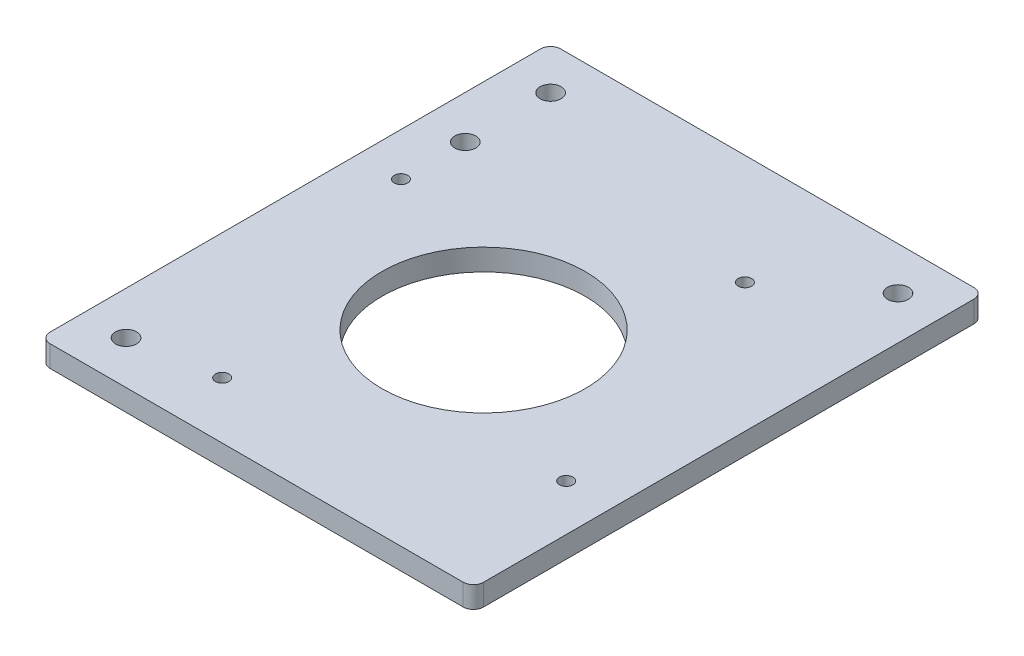
from build123d import *

# Parameters (mm, degrees)
SKETCH1_W           = 128
SKETCH1_H           = 150.8
SKETCH1_R           = 30
SKETCH1_R_2         = 3.1
BOSS_EXTRUDE1_DEPTH = 6.35
FILLET1_R           = 3
SKETCH3_R           = 1.985
CUT_EXTRUDE1_DEPTH  = 637.633938538


with BuildPart() as part:
    # Sketch1 → Boss-Extrude1 (new body)
    with BuildSketch(Plane(origin=(0, 0, 0), x_dir=(1, 0, 0), z_dir=(0, 1, 0))):
        with Locations((77.127334094, -545.362051651)):
            Rectangle(SKETCH1_W, SKETCH1_H)
        with Locations((76.627334094, -553.262051651)):
            Circle(SKETCH1_R, mode=Mode.SUBTRACT)
        with Locations((25.827334094, -482.662051651)):
            Circle(SKETCH1_R_2, mode=Mode.SUBTRACT)
        with Locations((128.427334094, -482.662051651)):
            Circle(SKETCH1_R_2, mode=Mode.SUBTRACT)
        with Locations((25.827334094, -608.062051651)):
            Circle(SKETCH1_R_2, mode=Mode.SUBTRACT)
        with Locations((25.827334094, -507.862051651)):
            Circle(SKETCH1_R_2, mode=Mode.SUBTRACT)
    extrude(amount=BOSS_EXTRUDE1_DEPTH)

    # Fillet1
    fillet1_edges = [part.edges().sort_by_distance(p)[0] for p in [
        (141.127334094, 3.175, 469.962051651),
        (141.127334094, 3.175, 620.762051651),
        (13.127334094, 3.175, 620.762051651),
        (13.127334094, 3.175, 469.962051651),
    ]]
    fillet(fillet1_edges, radius=FILLET1_R)

    # Sketch3 → Cut-Extrude1 (cut, through all)
    with BuildSketch(Plane(origin=(0, 6.35, 0), x_dir=(1, 0, 0), z_dir=(0, 1, 0))):
        with Locations((25.827334094, -526.868476675)):
            Circle(SKETCH3_R)
        with Locations((103.020909069, -502.462051651)):
            Circle(SKETCH3_R)
        with Locations((127.427334094, -579.655626627)):
            Circle(SKETCH3_R)
        with Locations((50.233759118, -604.062051651)):
            Circle(SKETCH3_R)
    extrude(amount=-CUT_EXTRUDE1_DEPTH, mode=Mode.SUBTRACT)


solid = part.part
